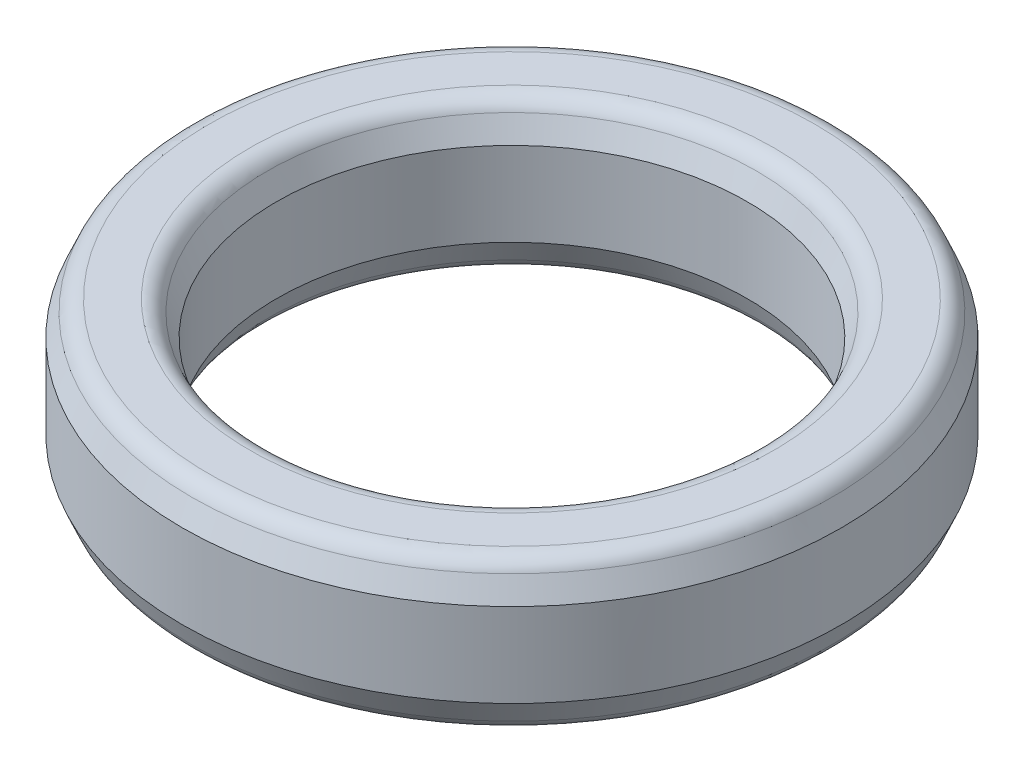
from build123d import *

# Parameters (mm, degrees)
GSK_CORNER_FILLET_R = 1.5875


with BuildPart() as part:
    # Gsk Profile → Gasket Body (revolve)
    with BuildSketch(Plane.XY):
        Polygon((-2.77495, -6.35), (2.77495, -6.35), (3.96875, -3.537583446), (3.96875, 3.537583446), (2.77495, 6.35), (-2.77495, 6.35), (-3.96875, 3.537583446), (-3.96875, -3.537583446), align=None)
    revolve(axis=Axis((23.8125, 24.442227624, 0), (0, -1, 0)))

    # Gsk Corner Fillet
    gsk_corner_fillet_edges = [part.edges().sort_by_distance(p)[0] for p in [
        (50.39995, -6.35, 0),
        (44.85005, -6.35, 0),
        (44.85005, 6.35, 0),
        (50.39995, 6.35, 0),
    ]]
    fillet(gsk_corner_fillet_edges, radius=GSK_CORNER_FILLET_R)


solid = part.part
